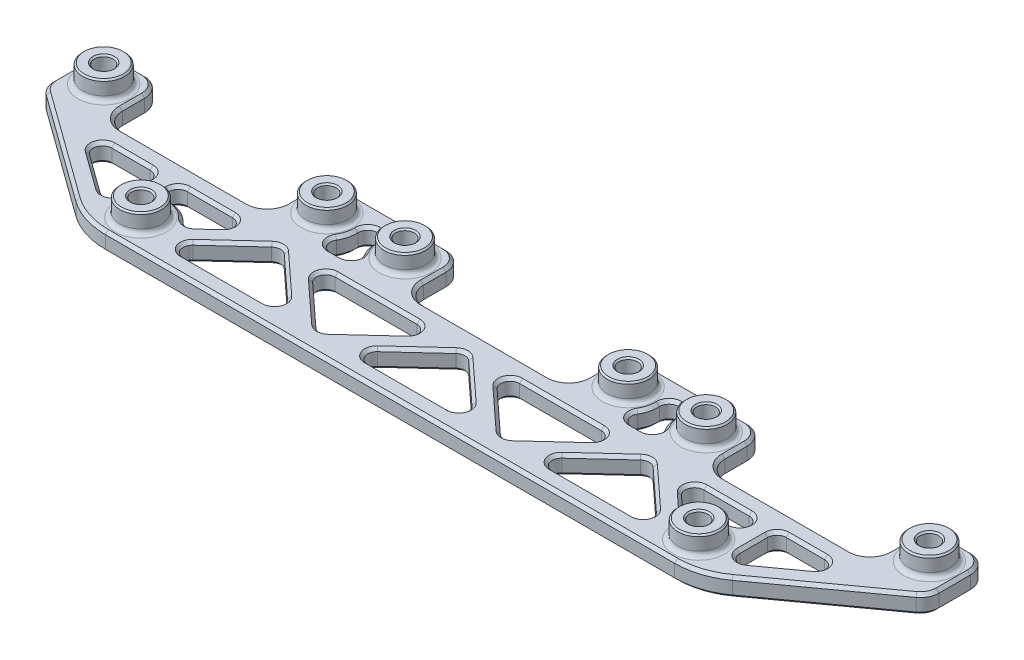
from build123d import *

# Parameters (mm, degrees)
BOSS_EXTRUDE2_DEPTH = 3.175
SKETCH3_R           = 3.571875
BOSS_EXTRUDE3_DEPTH = 3.175
CUT_EXTRUDE1_REACH  = 78.997
SKETCH4_R           = 1.5875
FILLET2_R           = 12.7
FILLET1_R           = 3.175
FILLET3_R           = 1.5875
FILLET4_R           = 0.79375
CHAMFER1_SIZE       = 0.508
CHAMFER2_SIZE       = 0.254


with BuildPart() as part:
    # Sketch2 → Boss-Extrude2 (new body)
    with BuildSketch(Plane(origin=(0, 0, 0), x_dir=(1, 0, 0), z_dir=(0, 1, 0))):
        Polygon((-42.53865, -13.3477), (-52.71135, -13.3477), (-75.565, 3.175), (-75.565, 13.335), (-65.405, 13.335), (-65.405, 3.175), (-37.465, 3.175), (-37.465, 13.335), (-13.97, 13.335), (-13.97, 3.175), (13.97, 3.175), (13.97, 13.335), (37.465, 13.335), (37.465, 3.175), (65.405, 3.175), (65.405, 13.335), (75.565, 13.335), (75.565, 3.175), (52.71135, -13.3477), (42.53865, -13.3477), align=None)
        Polygon((-65.754370176, 0), (-52.71135, 0), (-52.71135, -9.429824534), align=None, mode=Mode.SUBTRACT)
        Polygon((65.754370176, 0), (52.71135, 0), (52.71135, -9.429824534), align=None, mode=Mode.SUBTRACT)
        Polygon((0, 0), (-11.053804895, -10.1727), (11.053804895, -10.1727), align=None, mode=Mode.SUBTRACT)
        Polygon((-4.688617658, 0), (-15.742422553, -10.1727), (-26.796227447, 0), align=None, mode=Mode.SUBTRACT)
        Polygon((-42.53865, -10.1727), (-20.43104021, -10.1727), (-31.484845105, 0), align=None, mode=Mode.SUBTRACT)
        Polygon((4.688617658, 0), (15.742422553, -10.1727), (26.796227447, 0), align=None, mode=Mode.SUBTRACT)
        Polygon((42.53865, -10.1727), (31.484845105, 0), (20.43104021, -10.1727), align=None, mode=Mode.SUBTRACT)
        with BuildLine():
            Line((-42.53865, -5.857814646), (-36.173462763, 0))
            Line((-36.173462763, 0), (-42.53865, 0))
            Line((-42.53865, 0), (-49.53635, 0))
            Line((-49.53635, 0), (-49.53635, -3.547784736))
            ThreePointArc((-49.53635, -3.547784736), (-45.697398661, -3.554407319), (-42.956520399, -6.242376365))
            Line((-42.956520399, -6.242376365), (-42.53865, -5.857814646))
        make_face(mode=Mode.SUBTRACT)
        with BuildLine():
            Line((42.53865, -5.857814646), (36.173462763, 0))
            Line((36.173462763, 0), (42.53865, 0))
            Line((42.53865, 0), (49.53635, 0))
            Line((49.53635, 0), (49.53635, -3.547784736))
            ThreePointArc((49.53635, -3.547784736), (45.697398661, -3.554407319), (42.956520399, -6.242376365))
            Line((42.956520399, -6.242376365), (42.53865, -5.857814646))
        make_face(mode=Mode.SUBTRACT)
        with BuildLine():
            Line((-27.675713961, 10.16), (-23.759286039, 10.16))
            ThreePointArc((-23.759286039, 10.16), (-23.262113484, 5.415193669), (-19.05, 3.175))
            Line((-19.05, 3.175), (-32.385, 3.175))
            ThreePointArc((-32.385, 3.175), (-28.172886516, 5.415193669), (-27.675713961, 10.16))
        make_face(mode=Mode.SUBTRACT)
        with BuildLine():
            Line((23.759286039, 10.16), (27.675713961, 10.16))
            ThreePointArc((27.675713961, 10.16), (28.172886516, 5.415193669), (32.385, 3.175))
            Line((32.385, 3.175), (19.05, 3.175))
            ThreePointArc((19.05, 3.175), (23.262113484, 5.415193669), (23.759286039, 10.16))
        make_face(mode=Mode.SUBTRACT)
    extrude(amount=BOSS_EXTRUDE2_DEPTH)

    # Sketch3 → Boss-Extrude3 (add)
    with BuildSketch(Plane(origin=(0, 3.175, 0), x_dir=(1, 0, 0), z_dir=(0, 1, 0))):
        with Locations((-32.385, 8.255)):
            Circle(SKETCH3_R)
        with Locations((-19.05, 8.255)):
            Circle(SKETCH3_R)
        with Locations((19.05, 8.255)):
            Circle(SKETCH3_R)
        with Locations((32.385, 8.255)):
            Circle(SKETCH3_R)
        with Locations((70.485, 8.255)):
            Circle(SKETCH3_R)
        with Locations((-70.485, 8.255)):
            Circle(SKETCH3_R)
        with Locations((-47.625, -8.26135)):
            Circle(SKETCH3_R)
        with Locations((47.625, -8.26135)):
            Circle(SKETCH3_R)
    extrude(amount=BOSS_EXTRUDE3_DEPTH)

    # Sketch4 → Cut-Extrude1 (cut, up to next)
    with BuildSketch(Plane.XZ, mode=Mode.PRIVATE) as cut_extrude1_sk1:
        with Locations((-70.485, -8.255)):
            Circle(SKETCH4_R)
    cut_extrude1_tool1 = extrude(cut_extrude1_sk1.sketch, amount=-CUT_EXTRUDE1_REACH, mode=Mode.PRIVATE) & part.part
    # Sketch4 → Cut-Extrude1 (cut, up to next)
    with BuildSketch(Plane.XZ, mode=Mode.PRIVATE) as cut_extrude1_sk2:
        with Locations((-32.385, -8.255)):
            Circle(SKETCH4_R)
    cut_extrude1_tool2 = extrude(cut_extrude1_sk2.sketch, amount=-CUT_EXTRUDE1_REACH, mode=Mode.PRIVATE) & part.part
    # Sketch4 → Cut-Extrude1 (cut, up to next)
    with BuildSketch(Plane.XZ, mode=Mode.PRIVATE) as cut_extrude1_sk3:
        with Locations((-19.05, -8.255)):
            Circle(SKETCH4_R)
    cut_extrude1_tool3 = extrude(cut_extrude1_sk3.sketch, amount=-CUT_EXTRUDE1_REACH, mode=Mode.PRIVATE) & part.part
    # Sketch4 → Cut-Extrude1 (cut, up to next)
    with BuildSketch(Plane.XZ, mode=Mode.PRIVATE) as cut_extrude1_sk4:
        with Locations((19.05, -8.255)):
            Circle(SKETCH4_R)
    cut_extrude1_tool4 = extrude(cut_extrude1_sk4.sketch, amount=-CUT_EXTRUDE1_REACH, mode=Mode.PRIVATE) & part.part
    # Sketch4 → Cut-Extrude1 (cut, up to next)
    with BuildSketch(Plane.XZ, mode=Mode.PRIVATE) as cut_extrude1_sk5:
        with Locations((32.385, -8.255)):
            Circle(SKETCH4_R)
    cut_extrude1_tool5 = extrude(cut_extrude1_sk5.sketch, amount=-CUT_EXTRUDE1_REACH, mode=Mode.PRIVATE) & part.part
    # Sketch4 → Cut-Extrude1 (cut, up to next)
    with BuildSketch(Plane.XZ, mode=Mode.PRIVATE) as cut_extrude1_sk6:
        with Locations((70.485, -8.255)):
            Circle(SKETCH4_R)
    cut_extrude1_tool6 = extrude(cut_extrude1_sk6.sketch, amount=-CUT_EXTRUDE1_REACH, mode=Mode.PRIVATE) & part.part
    # Sketch4 → Cut-Extrude1 (cut, up to next)
    with BuildSketch(Plane.XZ, mode=Mode.PRIVATE) as cut_extrude1_sk7:
        with Locations((47.625, 8.26135)):
            Circle(SKETCH4_R)
    cut_extrude1_tool7 = extrude(cut_extrude1_sk7.sketch, amount=-CUT_EXTRUDE1_REACH, mode=Mode.PRIVATE) & part.part
    # Sketch4 → Cut-Extrude1 (cut, up to next)
    with BuildSketch(Plane.XZ, mode=Mode.PRIVATE) as cut_extrude1_sk8:
        with Locations((-47.625, 8.26135)):
            Circle(SKETCH4_R)
    cut_extrude1_tool8 = extrude(cut_extrude1_sk8.sketch, amount=-CUT_EXTRUDE1_REACH, mode=Mode.PRIVATE) & part.part
    add(cut_extrude1_tool1.solids().sort_by_distance((-70.485, 0, -8.255))[0], mode=Mode.SUBTRACT)
    add(cut_extrude1_tool2.solids().sort_by_distance((-32.385, 0, -8.255))[0], mode=Mode.SUBTRACT)
    add(cut_extrude1_tool3.solids().sort_by_distance((-19.05, 0, -8.255))[0], mode=Mode.SUBTRACT)
    add(cut_extrude1_tool4.solids().sort_by_distance((19.05, 0, -8.255))[0], mode=Mode.SUBTRACT)
    add(cut_extrude1_tool5.solids().sort_by_distance((32.385, 0, -8.255))[0], mode=Mode.SUBTRACT)
    add(cut_extrude1_tool6.solids().sort_by_distance((70.485, 0, -8.255))[0], mode=Mode.SUBTRACT)
    add(cut_extrude1_tool7.solids().sort_by_distance((47.625, 0, 8.26135))[0], mode=Mode.SUBTRACT)
    add(cut_extrude1_tool8.solids().sort_by_distance((-47.625, 0, 8.26135))[0], mode=Mode.SUBTRACT)

    # Fillet2
    fillet2_edges = [part.edges().sort_by_distance(p)[0] for p in [
        (-52.71135, 1.5875, 13.3477),
        (52.71135, 1.5875, 13.3477),
    ]]
    fillet(fillet2_edges, radius=FILLET2_R)

    # Fillet1
    fillet1_edges = [part.edges().sort_by_distance(p)[0] for p in [
        (-65.405, 1.5875, -3.175),
        (-37.465, 1.5875, -3.175),
        (-37.465, 1.5875, -13.335),
        (-13.97, 1.5875, -13.335),
        (-13.97, 1.5875, -3.175),
        (13.97, 1.5875, -3.175),
        (13.97, 1.5875, -13.335),
        (37.465, 1.5875, -13.335),
        (37.465, 1.5875, -3.175),
        (65.405, 1.5875, -3.175),
        (65.405, 1.5875, -13.335),
        (75.565, 1.5875, -3.175),
        (-75.565, 1.5875, -3.175),
        (-75.565, 1.5875, -13.335),
        (-65.405, 1.5875, -13.335),
        (75.565, 1.5875, -13.335),
    ]]
    fillet(fillet1_edges, radius=FILLET1_R)

    # Fillet3
    fillet3_edges = [part.edges().sort_by_distance(p)[0] for p in [
        (23.759286039, 1.5875, -10.16),
        (19.05, 1.5875, -3.175),
        (32.385, 1.5875, -3.175),
        (27.675713961, 1.5875, -10.16),
        (-19.05, 1.5875, -3.175),
        (-23.759286039, 1.5875, -10.16),
        (-27.675713961, 1.5875, -10.16),
        (36.173462763, 1.5875, 0),
        (26.796227447, 1.5875, 0),
        (4.688617658, 1.5875, 0),
        (-42.53865, 1.5875, 10.1727),
        (-20.43104021, 1.5875, 10.1727),
        (-31.484845105, 1.5875, 0),
        (-15.742422553, 1.5875, 10.1727),
        (-4.688617658, 1.5875, 0),
        (-26.796227447, 1.5875, 0),
        (-11.053804895, 1.5875, 10.1727),
        (11.053804895, 1.5875, 10.1727),
        (0, 1.5875, 0),
        (31.484845105, 1.5875, 0),
        (20.43104021, 1.5875, 10.1727),
        (42.53865, 1.5875, 10.1727),
        (-36.173462763, 1.5875, 0),
        (-52.71135, 1.5875, 0),
        (-65.754370176, 1.5875, 0),
        (-52.71135, 1.5875, 9.429824534),
        (15.742422553, 1.5875, 10.1727),
        (52.71135, 1.5875, 0),
        (65.754370176, 1.5875, 0),
        (52.71135, 1.5875, 9.429824534),
        (-49.53635, 1.5875, 3.547784736),
        (-42.956520399, 1.5875, 6.242376365),
        (-49.53635, 1.5875, 0),
        (42.956520399, 1.5875, 6.242376365),
        (49.53635, 1.5875, 3.547784736),
        (49.53635, 1.5875, 0),
    ]]
    fillet(fillet3_edges, radius=FILLET3_R)
    fillet3_2_edges = [part.edges().sort_by_distance(p)[0] for p in [
        (-32.385, 1.5875, -3.175),
    ]]
    fillet(fillet3_2_edges, radius=FILLET3_R)

    # Fillet4
    fillet4_edges = [part.edges().sort_by_distance(p)[0] for p in [
        (66.913125, 3.175, -8.255),
        (44.053125, 3.175, 8.26135),
        (28.813125, 3.175, -8.255),
        (15.478125, 3.175, -8.255),
        (-22.621875, 3.175, -8.255),
        (-35.956875, 3.175, -8.255),
        (-51.196875, 3.175, 8.26135),
        (-74.056875, 3.175, -8.255),
    ]]
    fillet(fillet4_edges, radius=FILLET4_R)

    # Chamfer1
    chamfer1_edges = [part.edges().sort_by_distance(p)[0] for p in [
        (24.560988039, 3.175, -9.667979075),
        (23.969754296, 3.175, -6.989133631),
        (23.34392906, 3.175, -3.987879317),
        (25.7175, 3.175, -3.175),
        (28.09107094, 3.175, -3.987879317),
        (27.465245704, 3.175, -6.989133631),
        (26.874011961, 3.175, -9.667979075),
        (25.7175, 3.175, -10.16),
        (-23.34392906, 3.175, -3.987879317),
        (-23.969754296, 3.175, -6.989133631),
        (-24.560988039, 3.175, -9.667979075),
        (-25.7175, 3.175, -10.16),
        (-26.874011961, 3.175, -9.667979075),
        (-27.465245704, 3.175, -6.989133631),
        (-28.09107094, 3.175, -3.987879317),
        (-25.7175, 3.175, -3.175),
        (42.731208534, 3.175, 5.393003786),
        (45.664061007, 3.175, 3.568198118),
        (49.043807791, 3.175, 2.744807023),
        (49.53635, 3.175, 1.591431038),
        (49.071382015, 3.175, 0.464967985),
        (44.095811178, 3.175, 0),
        (38.763828489, 3.175, 1.010541345),
        (40.373817178, 3.175, 3.865541844),
        (15.742422553, 3.175, 9.602757323),
        (20.309680552, 3.175, 5.969500659),
        (24.205861721, 3.175, 1.010541345),
        (15.742422553, 3.175, 0),
        (7.278983384, 3.175, 1.010541345),
        (11.175164554, 3.175, 5.969500659),
        (-39.948284274, 3.175, 9.162158655),
        (-31.484845105, 3.175, 10.1727),
        (-23.021405937, 3.175, 9.162158655),
        (-26.917587106, 3.175, 4.203199341),
        (-31.484845105, 3.175, 0.569942677),
        (-36.052103104, 3.175, 4.203199341),
        (-15.742422553, 3.175, 9.602757323),
        (-11.175164554, 3.175, 5.969500659),
        (-7.278983384, 3.175, 1.010541345),
        (-15.742422553, 3.175, 0),
        (-24.205861721, 3.175, 1.010541345),
        (-20.309680552, 3.175, 5.969500659),
        (-8.463439169, 3.175, 9.162158655),
        (0, 3.175, 10.1727),
        (8.463439169, 3.175, 9.162158655),
        (4.567257999, 3.175, 4.203199341),
        (0, 3.175, 0.569942677),
        (-4.567257999, 3.175, 4.203199341),
        (31.484845105, 3.175, 0.569942677),
        (26.917587106, 3.175, 4.203199341),
        (23.021405937, 3.175, 9.162158655),
        (31.484845105, 3.175, 10.1727),
        (39.948284274, 3.175, 9.162158655),
        (36.052103104, 3.175, 4.203199341),
        (-49.043807791, 3.175, 2.744807023),
        (-45.664061007, 3.175, 3.568198118),
        (-42.731208534, 3.175, 5.393003786),
        (-40.373817178, 3.175, 3.865541844),
        (-38.763828489, 3.175, 1.010541345),
        (-44.095811178, 3.175, 0),
        (-49.071382015, 3.175, 0.464967985),
        (-49.53635, 3.175, 1.591431038),
        (53.176317985, 3.175, 0.464967985),
        (52.71135, 3.175, 3.955329133),
        (53.576488064, 3.175, 7.736788162),
        (58.50405828, 3.175, 5.241820381),
        (62.359429573, 3.175, 1.098699738),
        (57.573952632, 3.175, 0),
        (-53.176317985, 3.175, 0.464967985),
        (-57.573952632, 3.175, 0),
        (-62.359429573, 3.175, 1.098699738),
        (-58.50405828, 3.175, 5.241820381),
        (-53.576488064, 3.175, 7.736788162),
        (-52.71135, 3.175, 3.955329133),
        (-14.89993597, 3.175, -12.40506403),
        (-13.97, 3.175, -8.255),
        (-13.04006403, 3.175, -4.10493597),
        (0, 3.175, -3.175),
        (13.04006403, 3.175, -4.10493597),
        (13.97, 3.175, -8.255),
        (14.89993597, 3.175, -12.40506403),
        (25.7175, 3.175, -13.335),
        (36.53506403, 3.175, -12.40506403),
        (37.465, 3.175, -8.255),
        (38.39493597, 3.175, -4.10493597),
        (51.435, 3.175, -3.175),
        (64.47506403, 3.175, -4.10493597),
        (65.405, 3.175, -8.255),
        (66.33493597, 3.175, -12.40506403),
        (70.485, 3.175, -13.335),
        (74.63506403, 3.175, -12.40506403),
        (75.565, 3.175, -7.478709197),
        (75.217259792, 3.175, -3.352694523),
        (65.146161888, 3.175, 4.357597046),
        (52.51166939, 3.175, 12.730694473),
        (0, 3.175, 13.3477),
        (-52.51166939, 3.175, 12.730694473),
        (-65.146161888, 3.175, 4.357597046),
        (-75.217259792, 3.175, -3.352694523),
        (-75.565, 3.175, -7.478709197),
        (-74.63506403, 3.175, -12.40506403),
        (-70.485, 3.175, -13.335),
        (-66.33493597, 3.175, -12.40506403),
        (-65.405, 3.175, -8.255),
        (-64.47506403, 3.175, -4.10493597),
        (-51.435, 3.175, -3.175),
        (-38.39493597, 3.175, -4.10493597),
        (-37.465, 3.175, -8.255),
        (-36.53506403, 3.175, -12.40506403),
        (-25.7175, 3.175, -13.335),
        (23.969754296, 0, -6.989133631),
        (23.34392906, 0, -3.987879317),
        (24.560988039, 0, -9.667979075),
        (25.7175, 0, -3.175),
        (25.7175, 0, -10.16),
        (28.09107094, 0, -3.987879317),
        (26.874011961, 0, -9.667979075),
        (27.465245704, 0, -6.989133631),
        (-27.465245704, 0, -6.989133631),
        (-28.09107094, 0, -3.987879317),
        (-26.874011961, 0, -9.667979075),
        (-25.7175, 0, -3.175),
        (-25.7175, 0, -10.16),
        (-23.34392906, 0, -3.987879317),
        (-24.560988039, 0, -9.667979075),
        (-23.969754296, 0, -6.989133631),
        (-53.576488064, 0, 7.736788162),
        (-52.71135, 0, 3.955329133),
        (-58.50405828, 0, 5.241820381),
        (-53.176317985, 0, 0.464967985),
        (-62.359429573, 0, 1.098699738),
        (-57.573952632, 0, 0),
        (-49.53635, 0, 1.591431038),
        (-49.043807791, 0, 2.744807023),
        (-49.071382015, 0, 0.464967985),
        (-45.664061007, 0, 3.568198118),
        (-44.095811178, 0, 0),
        (-42.731208534, 0, 5.393003786),
        (-38.763828489, 0, 1.010541345),
        (-40.373817178, 0, 3.865541844),
        (-39.948284274, 0, 9.162158655),
        (-31.484845105, 0, 10.1727),
        (-36.052103104, 0, 4.203199341),
        (-23.021405937, 0, 9.162158655),
        (-31.484845105, 0, 0.569942677),
        (-26.917587106, 0, 4.203199341),
        (-24.205861721, 0, 1.010541345),
        (-20.309680552, 0, 5.969500659),
        (-15.742422553, 0, 0),
        (-15.742422553, 0, 9.602757323),
        (-7.278983384, 0, 1.010541345),
        (-11.175164554, 0, 5.969500659),
        (-8.463439169, 0, 9.162158655),
        (0, 0, 10.1727),
        (-4.567257999, 0, 4.203199341),
        (8.463439169, 0, 9.162158655),
        (0, 0, 0.569942677),
        (4.567257999, 0, 4.203199341),
        (7.278983384, 0, 1.010541345),
        (11.175164554, 0, 5.969500659),
        (15.742422553, 0, 0),
        (15.742422553, 0, 9.602757323),
        (24.205861721, 0, 1.010541345),
        (20.309680552, 0, 5.969500659),
        (39.948284274, 0, 9.162158655),
        (36.052103104, 0, 4.203199341),
        (31.484845105, 0, 10.1727),
        (31.484845105, 0, 0.569942677),
        (23.021405937, 0, 9.162158655),
        (26.917587106, 0, 4.203199341),
        (45.664061007, 0, 3.568198118),
        (49.043807791, 0, 2.744807023),
        (42.731208534, 0, 5.393003786),
        (49.53635, 0, 1.591431038),
        (40.373817178, 0, 3.865541844),
        (49.071382015, 0, 0.464967985),
        (38.763828489, 0, 1.010541345),
        (44.095811178, 0, 0),
        (53.576488064, 0, 7.736788162),
        (58.50405828, 0, 5.241820381),
        (52.71135, 0, 3.955329133),
        (62.359429573, 0, 1.098699738),
        (53.176317985, 0, 0.464967985),
        (57.573952632, 0, 0),
        (0, 0, 13.3477),
        (52.51166939, 0, 12.730694473),
        (-52.51166939, 0, 12.730694473),
        (65.146161888, 0, 4.357597046),
        (-65.146161888, 0, 4.357597046),
        (75.217259792, 0, -3.352694523),
        (-75.217259792, 0, -3.352694523),
        (75.565, 0, -7.478709197),
        (-75.565, 0, -7.478709197),
        (74.63506403, 0, -12.40506403),
        (-74.63506403, 0, -12.40506403),
        (70.485, 0, -13.335),
        (-70.485, 0, -13.335),
        (66.33493597, 0, -12.40506403),
        (-66.33493597, 0, -12.40506403),
        (65.405, 0, -8.255),
        (-65.405, 0, -8.255),
        (64.47506403, 0, -4.10493597),
        (-64.47506403, 0, -4.10493597),
        (51.435, 0, -3.175),
        (-51.435, 0, -3.175),
        (38.39493597, 0, -4.10493597),
        (-38.39493597, 0, -4.10493597),
        (37.465, 0, -8.255),
        (-37.465, 0, -8.255),
        (36.53506403, 0, -12.40506403),
        (-36.53506403, 0, -12.40506403),
        (25.7175, 0, -13.335),
        (-25.7175, 0, -13.335),
        (14.89993597, 0, -12.40506403),
        (-14.89993597, 0, -12.40506403),
        (13.97, 0, -8.255),
        (-13.97, 0, -8.255),
        (13.04006403, 0, -4.10493597),
        (-13.04006403, 0, -4.10493597),
        (0, 0, -3.175),
    ]]
    chamfer(chamfer1_edges, length=CHAMFER1_SIZE)

    # Chamfer2
    chamfer2_edges = [part.edges().sort_by_distance(p)[0] for p in [
        (68.8975, 0, -8.255),
        (68.8975, 6.35, -8.255),
        (46.0375, 0, 8.26135),
        (46.0375, 6.35, 8.26135),
        (30.7975, 0, -8.255),
        (30.7975, 6.35, -8.255),
        (17.4625, 0, -8.255),
        (17.4625, 6.35, -8.255),
        (-20.6375, 0, -8.255),
        (-20.6375, 6.35, -8.255),
        (-33.9725, 0, -8.255),
        (-33.9725, 6.35, -8.255),
        (-49.2125, 0, 8.26135),
        (-49.2125, 6.35, 8.26135),
        (-72.0725, 0, -8.255),
        (-72.0725, 6.35, -8.255),
        (66.913125, 6.35, -8.255),
        (44.053125, 6.35, 8.26135),
        (28.813125, 6.35, -8.255),
        (15.478125, 6.35, -8.255),
        (-22.621875, 6.35, -8.255),
        (-35.956875, 6.35, -8.255),
        (-51.196875, 6.35, 8.26135),
        (-74.056875, 6.35, -8.255),
    ]]
    chamfer(chamfer2_edges, length=CHAMFER2_SIZE)


solid = part.part
